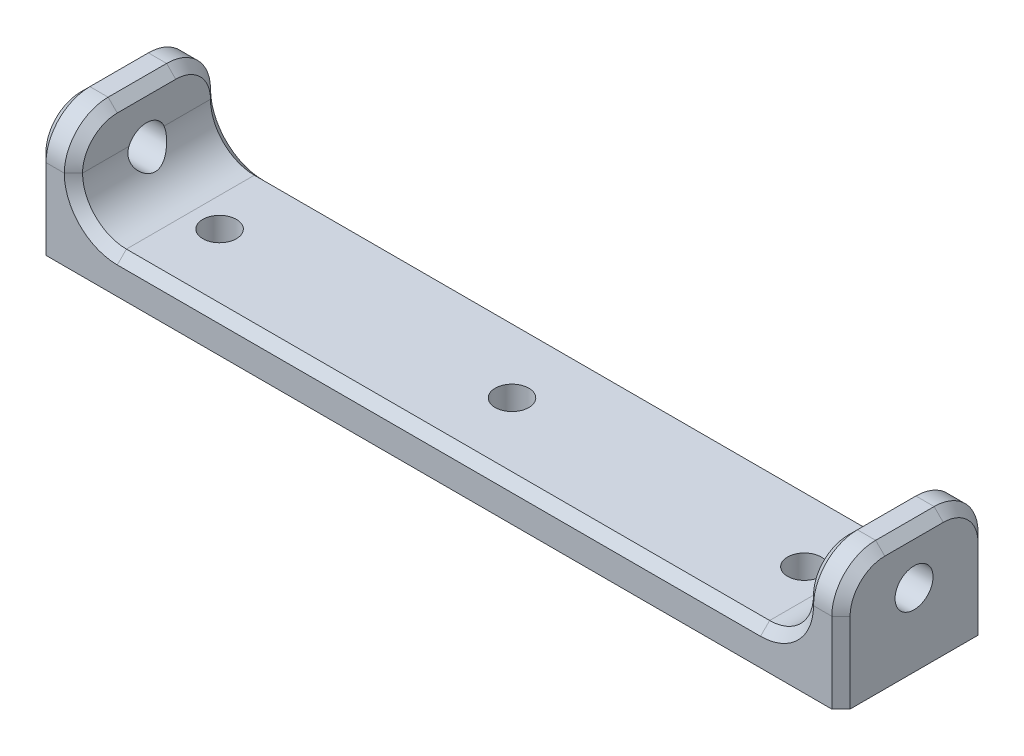
from build123d import *

# Parameters (mm, degrees)
BOSS_EXTRUDE1_DEPTH = 25.4
FILLET1_R           = 7.62
SKETCH2_R           = 2.921
CUT_EXTRUDE1_DEPTH  = 143.805838816
CHAMFER1_SIZE       = 1.5875
SKETCH3_R           = 3.302
CUT_EXTRUDE2_DEPTH  = 144.622345406


with BuildPart() as part:
    # Sketch1 → Boss-Extrude1 (new body)
    with BuildSketch(Plane.XY):
        Polygon((0, 0), (0, 21.59), (6.35, 21.59), (6.35, 6.35), (133.35, 6.35), (133.35, 21.59), (139.7, 21.59), (139.7, 0), align=None)
    extrude(amount=BOSS_EXTRUDE1_DEPTH)

    # Fillet1
    fillet1_edges = [part.edges().sort_by_distance(p)[0] for p in [
        (136.525, 21.59, 0),
        (136.525, 21.59, 25.4),
        (3.175, 21.59, 0),
        (3.175, 21.59, 25.4),
        (133.35, 6.35, 12.7),
        (6.35, 6.35, 12.7),
    ]]
    fillet(fillet1_edges, radius=FILLET1_R - 0.0001)  # a hair under: the kernel refuses the full size

    # Sketch2 → Cut-Extrude1 (cut, through all)
    with BuildSketch(Plane(origin=(0, 6.35, 0), x_dir=(1, 0, 0), z_dir=(0, 1, 0))):
        with Locations(Location((69.85, -12.7, 0), (0, 0, 270))):
            Circle(SKETCH2_R)
        with Locations(Location((120.65, -12.7, 0), (0, 0, 270))):
            Circle(SKETCH2_R)
        with Locations(Location((19.05, -12.7, 0), (0, 0, 270))):
            Circle(SKETCH2_R)
    extrude(amount=-CUT_EXTRUDE1_DEPTH, mode=Mode.SUBTRACT)

    # Chamfer1
    chamfer1_edges = [part.edges().sort_by_distance(p)[0] for p in [
        (139.7, 6.98505, 0),
        (133.35, 21.59, 12.7),
        (139.7, 21.59, 12.7),
        (133.35, 19.358182962, 23.168182962),
        (133.35, 19.358182962, 2.231817038),
        (0, 6.98505, 0),
        (69.85, 6.35, 0),
        (139.7, 19.358182962, 23.168182962),
        (139.7, 19.358182962, 2.231817038),
        (69.85, 6.35, 25.4),
        (0, 6.98505, 25.4),
        (0, 21.59, 12.7),
        (6.35, 21.59, 12.7),
        (0, 19.358182962, 23.168182962),
        (0, 19.358182962, 2.231817038),
        (6.35, 19.358182962, 23.168182962),
        (6.35, 19.358182962, 2.231817038),
        (131.118182962, 8.581817038, 0),
        (131.118182962, 8.581817038, 25.4),
        (8.581817038, 8.581817038, 0),
        (8.581817038, 8.581817038, 25.4),
        (139.7, 6.98505, 25.4),
    ]]
    chamfer(chamfer1_edges, length=CHAMFER1_SIZE)

    # Sketch3 → Cut-Extrude2 (cut, through all)
    with BuildSketch(Plane(origin=(139.7, 0, 0), x_dir=(0, 0, -1), z_dir=(1, 0, 0))):
        with Locations((-12.7, 12.7)):
            Circle(SKETCH3_R)
    extrude(amount=-CUT_EXTRUDE2_DEPTH, mode=Mode.SUBTRACT)


solid = part.part
